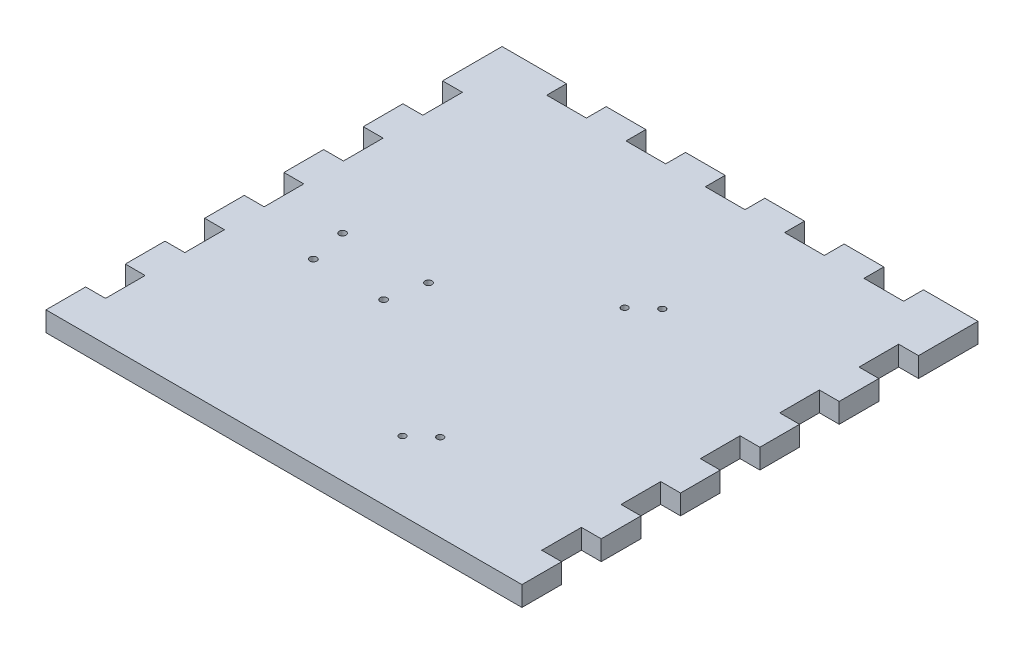
from build123d import *

# Parameters (mm, degrees)
SKETCH1_W               = 279.4
SKETCH1_H               = 279.4
BOSS_EXTRUDE1_DEPTH     = 12.7
SKETCH2_W               = 25.4
SKETCH2_H               = 12.7
BOSS_EXTRUDE2_DEPTH     = 12.7
LPATTERN1_COUNT         = 6
LPATTERN1_PITCH         = 50.8
MIRROR1_COPY_1_SKETCH_W = 25.4
MIRROR1_COPY_1_SKETCH_H = 12.7
MIRROR1_COPY_1_DEPTH    = 12.7
MIRROR1_COPY_2_SKETCH_W = 25.4
MIRROR1_COPY_2_SKETCH_H = 12.7
MIRROR1_COPY_2_DEPTH    = 12.7
MIRROR1_COPY_3_SKETCH_W = 25.4
MIRROR1_COPY_3_SKETCH_H = 12.7
MIRROR1_COPY_3_DEPTH    = 12.7
MIRROR1_COPY_4_SKETCH_W = 25.4
MIRROR1_COPY_4_SKETCH_H = 12.7
MIRROR1_COPY_4_DEPTH    = 12.7
MIRROR1_COPY_5_SKETCH_W = 25.4
MIRROR1_COPY_5_SKETCH_H = 12.7
MIRROR1_COPY_5_DEPTH    = 12.7
MIRROR1_COPY_6_SKETCH_W = 25.4
MIRROR1_COPY_6_SKETCH_H = 12.7
MIRROR1_COPY_6_DEPTH    = 12.7
SKETCH3_W               = 25.4
SKETCH3_H               = 12.7
BOSS_EXTRUDE3_DEPTH     = 12.7
LPATTERN2_COUNT         = 6
LPATTERN2_PITCH         = 50.8
SKETCH5_W               = 25.4
SKETCH5_H               = 12.7
BOSS_EXTRUDE4_DEPTH     = 12.7
SKETCH6_R               = 2.1
CUT_EXTRUDE1_DEPTH      = 216.9
SKETCH7_R               = 4.318
CUT_EXTRUDE2_DEPTH      = 6.35
SKETCH8_R               = 2.2225
CUT_EXTRUDE3_DEPTH      = 216.9
SKETCH9_R               = 6.35
CUT_EXTRUDE4_DEPTH      = 6.35


with BuildPart() as part:
    # Sketch1 → Boss-Extrude1 (new body)
    with BuildSketch(Plane(origin=(0, 0, 0), x_dir=(1, 0, 0), z_dir=(0, 1, 0))):
        Rectangle(SKETCH1_W, SKETCH1_H)
    extrude(amount=BOSS_EXTRUDE1_DEPTH)

    # Sketch2 → Boss-Extrude2 (add)
    with BuildSketch(Plane(origin=(139.7, 0, 0), x_dir=(0, 0, -1), z_dir=(1, 0, 0))):
        with Locations((-127, 6.35)):
            Rectangle(SKETCH2_W, SKETCH2_H)
    boss_extrude2 = extrude(amount=BOSS_EXTRUDE2_DEPTH)

    # LPattern1: Boss-Extrude2 ×6
    with Locations(*[(0, 0, -i * LPATTERN1_PITCH) for i in range(1, LPATTERN1_COUNT)]):
        add(boss_extrude2)

    # Mirror1 copy 1 sketch → Mirror1 copy 1 (add)
    with BuildSketch(Plane(origin=(-139.7, 0, -50.8), x_dir=(0, 0, -1), z_dir=(-1, 0, 0))):
        with Locations((-127, -6.35)):
            Rectangle(MIRROR1_COPY_1_SKETCH_W, MIRROR1_COPY_1_SKETCH_H)
    extrude(amount=MIRROR1_COPY_1_DEPTH)

    # Mirror1 copy 2 sketch → Mirror1 copy 2 (add)
    with BuildSketch(Plane(origin=(-139.7, 0, -101.6), x_dir=(0, 0, -1), z_dir=(-1, 0, 0))):
        with Locations((-127, -6.35)):
            Rectangle(MIRROR1_COPY_2_SKETCH_W, MIRROR1_COPY_2_SKETCH_H)
    extrude(amount=MIRROR1_COPY_2_DEPTH)

    # Mirror1 copy 3 sketch → Mirror1 copy 3 (add)
    with BuildSketch(Plane(origin=(-139.7, 0, -152.4), x_dir=(0, 0, -1), z_dir=(-1, 0, 0))):
        with Locations((-127, -6.35)):
            Rectangle(MIRROR1_COPY_3_SKETCH_W, MIRROR1_COPY_3_SKETCH_H)
    extrude(amount=MIRROR1_COPY_3_DEPTH)

    # Mirror1 copy 4 sketch → Mirror1 copy 4 (add)
    with BuildSketch(Plane(origin=(-139.7, 0, -203.2), x_dir=(0, 0, -1), z_dir=(-1, 0, 0))):
        with Locations((-127, -6.35)):
            Rectangle(MIRROR1_COPY_4_SKETCH_W, MIRROR1_COPY_4_SKETCH_H)
    extrude(amount=MIRROR1_COPY_4_DEPTH)

    # Mirror1 copy 5 sketch → Mirror1 copy 5 (add)
    with BuildSketch(Plane(origin=(-139.7, 0, -254), x_dir=(0, 0, -1), z_dir=(-1, 0, 0))):
        with Locations((-127, -6.35)):
            Rectangle(MIRROR1_COPY_5_SKETCH_W, MIRROR1_COPY_5_SKETCH_H)
    extrude(amount=MIRROR1_COPY_5_DEPTH)

    # Mirror1 copy 6 sketch → Mirror1 copy 6 (add)
    with BuildSketch(Plane(origin=(-139.7, 0, 0), x_dir=(0, 0, -1), z_dir=(-1, 0, 0))):
        with Locations((-127, -6.35)):
            Rectangle(MIRROR1_COPY_6_SKETCH_W, MIRROR1_COPY_6_SKETCH_H)
    extrude(amount=MIRROR1_COPY_6_DEPTH)

    # Sketch3 → Boss-Extrude3 (add)
    with BuildSketch(Plane(origin=(0, 0, -139.7), x_dir=(-1, 0, 0), z_dir=(0, 0, -1))):
        with Locations((-130.175, 6.35)):
            Rectangle(SKETCH3_W, SKETCH3_H)
    boss_extrude3 = extrude(amount=BOSS_EXTRUDE3_DEPTH)

    # LPattern2: Boss-Extrude3 ×6
    with Locations(*[(-i * LPATTERN2_PITCH, 0, 0) for i in range(1, LPATTERN2_COUNT)]):
        add(boss_extrude3)

    # Sketch5 → Boss-Extrude4 (add)
    with BuildSketch(Plane(origin=(0, 0, -139.7), x_dir=(-1, 0, 0), z_dir=(0, 0, -1))):
        with Locations((-139.7, 6.35)):
            Rectangle(SKETCH5_W, SKETCH5_H)
    boss_extrude4 = extrude(amount=BOSS_EXTRUDE4_DEPTH)

    # Mirror2: Boss-Extrude4 across plane
    add(boss_extrude4.mirror(Plane(origin=(0, 0, 0), x_dir=(0, 0, 1), z_dir=(1, 0, 0))))

    # Sketch6 → Cut-Extrude1 (cut, through all)
    with BuildSketch(Plane.XZ):
        with Locations((44.45, -58.145648771)):
            Circle(SKETCH6_R)
        with Locations((31.75, -46.715648771)):
            Circle(SKETCH6_R)
        with Locations((31.75, 95.524351229)):
            Circle(SKETCH6_R)
        with Locations((44.45, 84.094351229)):
            Circle(SKETCH6_R)
    extrude(amount=-CUT_EXTRUDE1_DEPTH, mode=Mode.SUBTRACT)

    # Sketch7 → Cut-Extrude2 (cut)
    with BuildSketch(Plane.XZ):
        with Locations((31.75, 95.524351229)):
            Circle(SKETCH7_R)
        with Locations((44.45, 84.094351229)):
            Circle(SKETCH7_R)
        with Locations((31.75, -46.715648771)):
            Circle(SKETCH7_R)
        with Locations((44.45, -58.145648771)):
            Circle(SKETCH7_R)
    extrude(amount=-CUT_EXTRUDE2_DEPTH, mode=Mode.SUBTRACT)

    # Sketch8 → Cut-Extrude3 (cut, through all)
    with BuildSketch(Plane(origin=(0, 12.7, 0), x_dir=(1, 0, 0), z_dir=(0, 1, 0))):
        with Locations((-49.920301731, -25.948881859)):
            Circle(SKETCH8_R)
        with Locations((-44.920301731, -2.218881859)):
            Circle(SKETCH8_R)
        with Locations((-94.920301731, -25.948881859)):
            Circle(SKETCH8_R)
        with Locations((-99.920301731, -2.218881859)):
            Circle(SKETCH8_R)
    extrude(amount=-CUT_EXTRUDE3_DEPTH, mode=Mode.SUBTRACT)

    # Sketch9 → Cut-Extrude4 (cut)
    with BuildSketch(Plane.XZ):
        with Locations((-94.920301731, 25.948881859)):
            Circle(SKETCH9_R)
        with Locations((-99.920301731, 2.218881859)):
            Circle(SKETCH9_R)
        with Locations((-44.920301731, 2.218881859)):
            Circle(SKETCH9_R)
        with Locations((-49.920301731, 25.948881859)):
            Circle(SKETCH9_R)
    extrude(amount=-CUT_EXTRUDE4_DEPTH, mode=Mode.SUBTRACT)


solid = part.part
